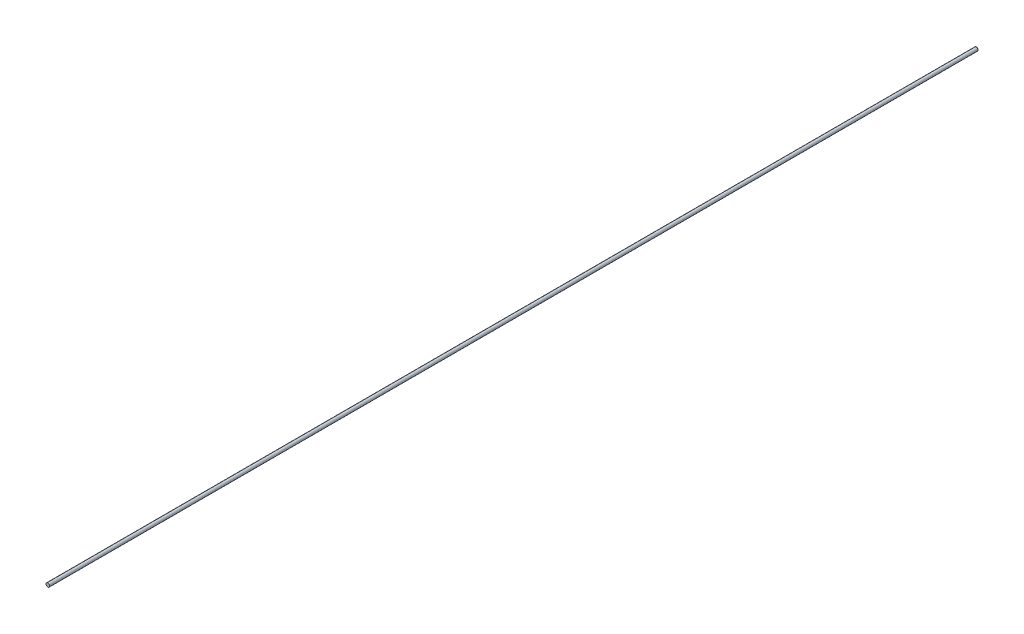
from build123d import *

# Parameters (mm, degrees)
SKETCH1_R           = 2
BOSS_EXTRUDE1_DEPTH = 1034.05


# Read off the part's stored shape, not the designer's step: M4 Machine Threads Stud1
with BuildPart() as part:
    # Sketch1 → Boss-Extrude1 (new body)
    with BuildSketch(Plane.XY):
        Circle(SKETCH1_R)
    extrude(amount=BOSS_EXTRUDE1_DEPTH)

    # M4 Machine Threads Stud1 outline → M4 Machine Threads Stud1 (revolve, cut)
    with BuildSketch(Plane.XZ):
        Polygon((2, 0.39), (1.61, 0), (2, 0), align=None)
    revolve(axis=Axis((0, 0, 0), (0, 0, 1)), mode=Mode.SUBTRACT)


solid = part.part
